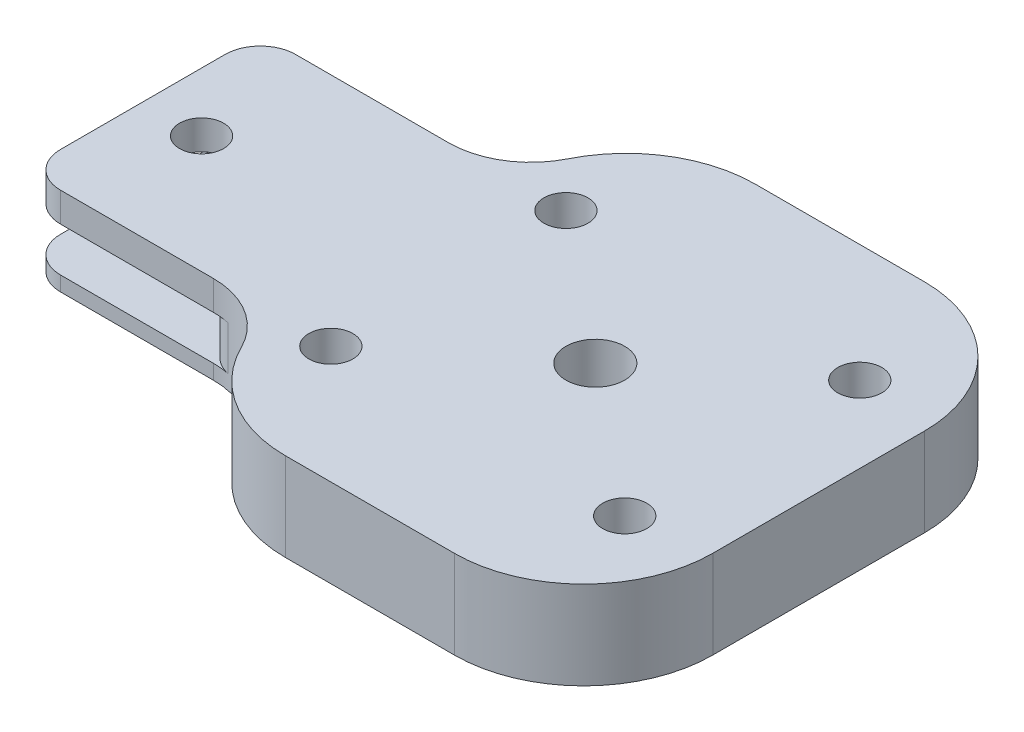
from build123d import *

# Parameters (mm, degrees)
SKETCH1_W           = 50.8
SKETCH1_H           = 9.525
BOSS_EXTRUDE1_DEPTH = 73.025
CUT_EXTRUDE2_DEPTH  = 19.05
SKETCH4_R           = 2.38125
CUT_EXTRUDE3_DEPTH  = 78.90081033
SKETCH5_W           = 12.7
SKETCH5_H           = 9.525
CUT_EXTRUDE4_DEPTH  = 29.21
FILLET2_R           = 8.89
FILLET3_R           = 3.81
FILLET4_R           = 13.97
FILLET5_R           = 13.97
CUT_EXTRUDE10_DEPTH = 3.175
SKETCH14_R          = 3.175
CUT_EXTRUDE11_DEPTH = 78.576627575
SKETCH17_R          = 2.38125
CUT_EXTRUDE12_DEPTH = 78.900810468
SKETCH19_W          = 19.05
SKETCH19_H          = 4.7625
CUT_EXTRUDE14_DEPTH = 6.0325
FILLET8_R           = 3.81
FILLET9_R           = 3.81


with BuildPart() as part:
    # Sketch1 → Boss-Extrude1 (new body)
    with BuildSketch(Plane(origin=(0, 0, 0), x_dir=(0, 0, -1), z_dir=(1, 0, 0))):
        Rectangle(SKETCH1_W, SKETCH1_H)
    extrude(amount=-BOSS_EXTRUDE1_DEPTH)

    # Sketch3 → Cut-Extrude2 (cut)
    with BuildSketch(Plane.ZY.offset(73.025)):
        Polygon((-6.6675, -3.175), (6.6675, -3.175), (6.6675, -0.79375), (6.6675, 1.5875), (-6.6675, 1.5875), (-6.6675, -0.79375), align=None)
    extrude(amount=-CUT_EXTRUDE2_DEPTH, mode=Mode.SUBTRACT)

    # Sketch4 → Cut-Extrude3 (cut, through all)
    with BuildSketch(Plane(origin=(0, 4.7625, 0), x_dir=(1, 0, 0), z_dir=(0, 1, 0))):
        with Locations(Location((-66.675, 0, 0), (0, 0, 270))):
            Circle(SKETCH4_R)
    extrude(amount=-CUT_EXTRUDE3_DEPTH, mode=Mode.SUBTRACT)

    # Sketch5 → Cut-Extrude4 (cut)
    with BuildSketch(Plane.ZY.offset(73.025)):
        with Locations((-19.05, 0)):
            Rectangle(SKETCH5_W, SKETCH5_H)
        with Locations((19.05, 0)):
            Rectangle(SKETCH5_W, SKETCH5_H)
    extrude(amount=-CUT_EXTRUDE4_DEPTH, mode=Mode.SUBTRACT)

    # Fillet2
    fillet2_edges = [part.edges().sort_by_distance(p)[0] for p in [
        (-43.815, 0, -12.7),
        (-43.815, 0, 12.7),
    ]]
    fillet(fillet2_edges, radius=FILLET2_R)

    # Fillet3
    fillet3_edges = [part.edges().sort_by_distance(p)[0] for p in [
        (-73.025, 0, -12.7),
    ]]
    fillet(fillet3_edges, radius=FILLET3_R)

    # Fillet4
    fillet4_edges = [part.edges().sort_by_distance(p)[0] for p in [
        (-43.815, 0, 25.4),
        (-43.815, 0, -25.4),
    ]]
    fillet(fillet4_edges, radius=FILLET4_R)

    # Fillet5
    fillet5_edges = [part.edges().sort_by_distance(p)[0] for p in [
        (0, 0, 25.4),
        (0, 0, -25.4),
    ]]
    fillet(fillet5_edges, radius=FILLET5_R)

    # Sketch13 → Cut-Extrude10 (cut)
    with BuildSketch(Plane.XZ.offset(4.7625)):
        with BuildLine():
            Line((-30.48, 6.35), (-30.48, 15.08125))
            ThreePointArc((-30.48, 15.08125), (-24.13, 21.43125), (-17.78, 15.08125))
            Line((-17.78, 15.08125), (-17.78, 6.35))
            Line((-17.78, 6.35), (-8.255, 6.35))
            ThreePointArc((-8.255, 6.35), (-1.905, 0), (-8.255, -6.35))
            Line((-8.255, -6.35), (-17.78, -6.35))
            Line((-17.78, -6.35), (-17.78, -15.08125))
            ThreePointArc((-17.78, -15.08125), (-24.13, -21.43125), (-30.48, -15.08125))
            Line((-30.48, -15.08125), (-30.48, -6.35))
            Line((-30.48, -6.35), (-40.005, -6.35))
            ThreePointArc((-40.005, -6.35), (-46.355, 0), (-40.005, 6.35))
            Line((-40.005, 6.35), (-30.48, 6.35))
        make_face()
    extrude(amount=-CUT_EXTRUDE10_DEPTH, mode=Mode.SUBTRACT)

    # Sketch14 → Cut-Extrude11 (cut, through all)
    with BuildSketch(Plane.XZ.offset(1.5875)):
        with Locations(Location((-24.13, 0, 0), (0, 0, 270))):
            Circle(SKETCH14_R)
    extrude(amount=-CUT_EXTRUDE11_DEPTH, mode=Mode.SUBTRACT)

    # Sketch17 → Cut-Extrude12 (cut, through all)
    with BuildSketch(Plane(origin=(0, -4.7625, 0), x_dir=(-1, 0, 0), z_dir=(0, -1, 0))):
        with Locations(Location((40.005, -12.7, 0), (0, 0, 90))):
            Circle(SKETCH17_R)
        with Locations(Location((40.005, 12.7, 0), (0, 0, 90))):
            Circle(SKETCH17_R)
        with Locations(Location((8.255, -12.7, 0), (0, 0, 90))):
            Circle(SKETCH17_R)
        with Locations(Location((8.255, 12.7, 0), (0, 0, 90))):
            Circle(SKETCH17_R)
    extrude(amount=-CUT_EXTRUDE12_DEPTH, mode=Mode.SUBTRACT)

    # Sketch19 → Cut-Extrude14 (cut)
    with BuildSketch(Plane.XY.offset(12.7)):
        with Locations((-63.5, -0.79375)):
            Rectangle(SKETCH19_W, SKETCH19_H)
    extrude(amount=-CUT_EXTRUDE14_DEPTH, mode=Mode.SUBTRACT)

    # Fillet8
    # the kernel refuses this fillet: 3.81 mm, written as the material it takes off along each edge
    with BuildSketch(Plane(origin=(-53.975, 1.5875, 12.7), x_dir=(0, 0, -1), z_dir=(0, -1, 0))) as fillet8_piece_1:
        with BuildLine():
            CenterArc((3.553407893, 3.81), FILLET8_R, 191.536959033, 78.463040967)
            Line((-0.179614475, 3.048), (-0.552916711, 2.9718))
            ThreePointArc((-0.552916711, 2.9718), (-0.381, 1.27), (-0.381, 0))
            Line((-0.381, 0), (0, -0.381))
            Line((0, -0.381), (3.553407893, -0.381))
            Line((3.553407893, -0.381), (3.553407893, 0))
        make_face()
    extrude(amount=4.7625, mode=Mode.SUBTRACT)

    # Fillet9
    fillet9_edges = [part.edges().sort_by_distance(p)[0] for p in [
        (-73.025, -3.96875, 12.7),
        (-73.025, 3.175, 12.7),
    ]]
    fillet(fillet9_edges, radius=FILLET9_R)


solid = part.part
